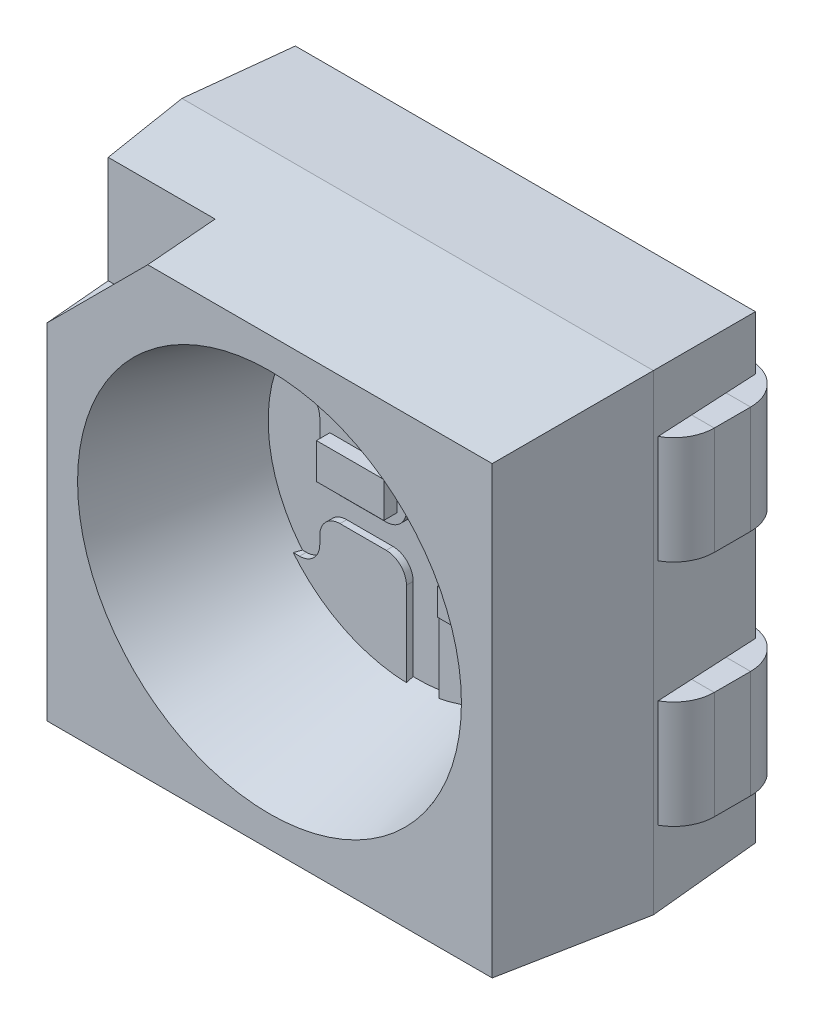
from build123d import *

# Parameters (mm, degrees)
SKETCH_1_W                       = 3.5
SKETCH_1_H                       = 3.5
EXTRUDE_1_DEPTH                  = 0.8
EXTRUDE_1_DRAFT                  = -3
SKETCH_3_R                       = 0.55
SKETCH_3_W                       = 0.705840171
SKETCH_3_H                       = 0.8
SKETCH_3_W_2                     = 0.610307383
CUT_EXTRUDE_1_DEPTH              = 0.13
SKETCH_5_W                       = 0.7
SKETCH_5_H                       = 0.8
SM_BASE_FLANGE_1_DEPTH           = 0.2
SM_EDGE_FLANGE_1_STRIP_W         = 1
SM_EDGE_FLANGE_1_STRIP_H         = 0.2
SM_EDGE_FLANGE_1_STRIP_CUT_DEPTH = 0.8
SM_EDGE_FLANGE_1_DEPTH           = 0.8
SM_EDGE_FLANGE_2_STRIP_W         = 1
SM_EDGE_FLANGE_2_STRIP_H         = 0.2
SM_EDGE_FLANGE_2_STRIP_CUT_DEPTH = 0.8
SM_EDGE_FLANGE_2_DEPTH           = 0.8
PATTERN_LINEAR_1_COUNT           = 2
PATTERN_LINEAR_1_PITCH           = 1.7
SKETCH_30_W                      = 3.5
SKETCH_30_H                      = 3.5
EXTRUDE_3_DEPTH                  = 1.1
EXTRUDE_3_TAPER                  = 5
CUT_EXTRUDE_2_DEPTH              = 0.5
SKETCH_34_R                      = 1.1
CUT_EXTRUDE_3_DEPTH              = 1.1
CHAMFER_1_SIZE                   = 0.325
CHAMFER_1_SIZE_2                 = 1.133409694
EXTRUDE_4_DEPTH                  = 0.05
EXTRUDE_4_2_DEPTH                = 0.05
EXTRUDE_4_3_DEPTH                = 0.05
EXTRUDE_4_4_DEPTH                = 0.05
SKETCH_49_W                      = 0.499821424
SKETCH_49_H                      = 0.263797991
EXTRUDE_5_DEPTH                  = 0.1
SKETCH_49_W_2                    = 0.2
SKETCH_49_H_2                    = 0.2
EXTRUDE_5_2_DEPTH                = 0.1
SKETCH_49_W_3                    = 0.191122393
EXTRUDE_5_3_DEPTH                = 0.1
SKETCH_49_W_4                    = 0.185203988
EXTRUDE_5_4_DEPTH                = 0.1


# Sheet-metal steps are written as plain solids
with BuildPart() as part:
    # Sketch 1 → Бобышка-Вытянуть1 (with draft: the straight prism first)
    with BuildSketch(Plane.XY):
        Rectangle(SKETCH_1_W, SKETCH_1_H)
    extrude(amount=-EXTRUDE_1_DEPTH)
    # Бобышка-Вытянуть1: the draft: its side faces are tilted about the plane it starts from
    extrude_1_sides = [part.faces().sort_by_distance(p)[0] for p in [
        (-1.75, 0, -0.4),
        (0, -1.75, -0.4),
        (1.75, 0, -0.4),
        (0, 1.75, -0.4),
    ]]
    draft(extrude_1_sides, Plane.XY, EXTRUDE_1_DRAFT)

    # Sketch 3 → Вырез-Вытянуть1 (cut)
    with BuildSketch(Plane(origin=(0, 0, -0.8), x_dir=(-1, 0, 0), z_dir=(0, 0, -1))):
        Circle(SKETCH_3_R)
        with Locations((-1.355153691, 0.906864755)):
            Rectangle(SKETCH_3_W, SKETCH_3_H)
        with Locations((1.402920085, 0.906864755)):
            Rectangle(SKETCH_3_W_2, SKETCH_3_H)
        with Locations((-1.355153691, -0.793135245)):
            Rectangle(SKETCH_3_W, SKETCH_3_H)
        with Locations((1.402920085, -1.031434947)):
            Rectangle(SKETCH_3_W_2, SKETCH_3_H)
    extrude(amount=-CUT_EXTRUDE_1_DEPTH, mode=Mode.SUBTRACT)



with BuildPart() as body_2:
    # Sketch 5 → Базовая кромка1 (new body)
    with BuildSketch(Plane(origin=(0, 0, -0.67), x_dir=(-1, 0, 0), z_dir=(0, 0, -1))):
        with Locations((-1.352233606, 0.906864755)):
            Rectangle(SKETCH_5_W, SKETCH_5_H)
    extrude(amount=SM_BASE_FLANGE_1_DEPTH)

    # Ребро-кромка1 strip (across the edge) → Ребро-кромка1 strip cut (cut)
    with BuildSketch(Plane(origin=(1.702233606, 0.506864755, -0.67), x_dir=(-1, 0, 0), z_dir=(0, 1, 0))):
        with Locations((-0.4, -0.1)):
            Rectangle(SM_EDGE_FLANGE_1_STRIP_W, SM_EDGE_FLANGE_1_STRIP_H)
    extrude(amount=SM_EDGE_FLANGE_1_STRIP_CUT_DEPTH, mode=Mode.SUBTRACT)

    # Ребро-кромка1 section (across the edge) → Ребро-кромка1 (add)
    with BuildSketch(Plane(origin=(1.702233606, 0.506864755, -0.67), x_dir=(-1, 0, 0), z_dir=(0, 1, 0))):
        with BuildLine():
            Line((-0.2, 0.1), (-0.2, 0.67))
            Line((-0.2, 0.67), (0, 0.67))
            Line((0, 0.67), (0, 0.1))
            ThreePointArc((0, 0.1), (0.029289322, 0.029289322), (0.1, 0))
            Line((0.1, 0), (0.1, -0.2))
            ThreePointArc((0.1, -0.2), (-0.112132034, -0.112132034), (-0.2, 0.1))
        make_face()
    extrude(amount=SM_EDGE_FLANGE_1_DEPTH)

    # Ребро-кромка2 strip (across the edge) → Ребро-кромка2 strip cut (cut)
    with BuildSketch(Plane(origin=(1.702233606, 0.506864755, 0), x_dir=(0, 0, -1), z_dir=(0, 1, 0))):
        with Locations((-0.2, -0.1)):
            Rectangle(SM_EDGE_FLANGE_2_STRIP_W, SM_EDGE_FLANGE_2_STRIP_H)
    extrude(amount=SM_EDGE_FLANGE_2_STRIP_CUT_DEPTH, mode=Mode.SUBTRACT)

    # Ребро-кромка2 section (across the edge) → Ребро-кромка2 (add)
    with BuildSketch(Plane(origin=(1.702233606, 0.506864755, 0), x_dir=(0, 0, -1), z_dir=(0, 1, 0))):
        with BuildLine():
            Line((0, 0.1), (0, 0.4))
            Line((0, 0.4), (0.2, 0.4))
            Line((0.2, 0.4), (0.2, 0.1))
            ThreePointArc((0.2, 0.1), (0.229289322, 0.029289322), (0.3, 0))
            Line((0.3, 0), (0.3, -0.2))
            ThreePointArc((0.3, -0.2), (0.087867966, -0.112132034), (0, 0.1))
        make_face()
    extrude(amount=SM_EDGE_FLANGE_2_DEPTH)


with BuildPart() as pattern_linear_1_1:
    # Линейный массив1: pattern copy
    add(body_2.part.moved(Location(Vector(0, -1, 0) * (1 * PATTERN_LINEAR_1_PITCH))))


with BuildPart() as body_4:
    # Зеркальное отражение1: mirrored copy
    add(body_2.part.mirror(Plane(origin=(0, 0, 0), x_dir=(0, 0, 1), z_dir=(1, 0, 0))))


with BuildPart() as body_5:
    # Mirror 1 2: mirrored copy
    add(pattern_linear_1_1.part.mirror(Plane(origin=(0, 0, 0), x_dir=(0, 0, 1), z_dir=(1, 0, 0))))


with BuildPart() as part_1:
    add(part.part)

    add(body_2.part)  # Бобышка-Вытянуть3 merges body 2

    add(pattern_linear_1_1.part)  # Бобышка-Вытянуть3 merges Линейный массив1_1

    add(body_4.part)  # Бобышка-Вытянуть3 merges body 4

    add(body_5.part)  # Бобышка-Вытянуть3 merges body 5
    # Эскиз30 → Бобышка-Вытянуть3 (add)
    with BuildSketch(Plane.XY):
        Rectangle(SKETCH_30_W, SKETCH_30_H)
    extrude(amount=EXTRUDE_3_DEPTH, taper=EXTRUDE_3_TAPER)

    # Эскиз33 → Вырез-Вытянуть2 (cut)
    with BuildSketch(Plane.XY.offset(1.1)):
        Polygon((-0.90376247, 1.65376247), (-1.65376247, 0.90376247), (-2.879687624, 0.90376247), (-2.879687624, 2.879687624), (-0.90376247, 2.879687624), align=None)
    extrude(amount=-CUT_EXTRUDE_2_DEPTH, mode=Mode.SUBTRACT)

    # Эскиз34 → Вырез-Вытянуть3 (cut)
    with BuildSketch(Plane.XY.offset(1.1)):
        Circle(SKETCH_34_R)
    extrude(amount=-CUT_EXTRUDE_3_DEPTH, mode=Mode.SUBTRACT)

    # Фаска1
    # the kernel refuses this chamfer: 1.133409694, 0.325 mm, written as the material it takes off along each edge
    with BuildSketch(Plane(origin=(0, 0, 1.1), x_dir=(1, 0, 0), z_dir=(0, -1, 0))) as chamfer_1_piece_1_section:
        Polygon((1.1 + CHAMFER_1_SIZE, 0), (1.1, -CHAMFER_1_SIZE_2), (1.1, 0), align=None)
    chamfer_1_piece_1 = revolve(axis=Axis((0, 0, 1.1), (0, 0, 1)), mode=Mode.PRIVATE)
    chamfer_1_piece_1 = split(chamfer_1_piece_1, bisect_by=Plane(origin=(-1.262154842, 0, 0), z_dir=(0, 0, 1)), keep=Keep.TOP, mode=Mode.PRIVATE)
    add(chamfer_1_piece_1, mode=Mode.SUBTRACT)


with BuildPart() as body_2_2:
    # Эскиз48 → Бобышка-Вытянуть4 (new body)
    with BuildSketch(Plane.XY):
        with BuildLine():
            Line((0.210318716, -1.45465193), (0.210318716, 0.099827842))
            ThreePointArc((0.210318716, 0.099827842), (0.254252699, 0.205893859), (0.360318716, 0.249827842))
            Line((0.360318716, 0.249827842), (0.596091857, 0.249827842))
            ThreePointArc((0.596091857, 0.249827842), (0.702157875, 0.205893859), (0.746091857, 0.099827842))
            Line((0.746091857, 0.099827842), (0.746091857, -0.686015987))
            ThreePointArc((0.746091857, -0.686015987), (0.79002584, -0.792082004), (0.896091857, -0.836015987))
            Line((0.896091857, -0.836015987), (1.321228911, -0.836015987))
            Line((1.321228911, -0.836015987), (1.321228911, -1.45465193))
            Line((1.321228911, -1.45465193), (0.210318716, -1.45465193))
        make_face()
    extrude(amount=EXTRUDE_4_DEPTH)


with BuildPart() as body_3:
    # Эскиз48 → Extrude 4 2 (new body)
    with BuildSketch(Plane.XY):
        with BuildLine():
            Line((0.210318716, 1.509106996), (1.529342803, 1.509106996))
            Line((1.529342803, 1.509106996), (1.529342803, 0.436478181))
            Line((1.529342803, 0.436478181), (0.360318716, 0.436478181))
            ThreePointArc((0.360318716, 0.436478181), (0.254252699, 0.480412163), (0.210318716, 0.586478181))
            Line((0.210318716, 0.586478181), (0.210318716, 1.509106996))
        make_face()
    extrude(amount=EXTRUDE_4_2_DEPTH)


with BuildPart() as body_4_2:
    # Эскиз48 → Extrude 4 3 (new body)
    with BuildSketch(Plane.XY):
        with BuildLine():
            Line((-0.033165046, -1.549652247), (-0.033165046, -0.49711606))
            ThreePointArc((-0.033165046, -0.49711606), (-0.077099029, -0.391050043), (-0.183165046, -0.34711606))
            Line((-0.183165046, -0.34711606), (-0.526546559, -0.34711606))
            ThreePointArc((-0.526546559, -0.34711606), (-0.632612577, -0.391050043), (-0.676546559, -0.49711606))
            Line((-0.676546559, -0.49711606), (-0.676546559, -0.556593928))
            ThreePointArc((-0.676546559, -0.556593928), (-0.720480542, -0.662659945), (-0.826546559, -0.706593928))
            Line((-0.826546559, -0.706593928), (-1.505672411, -0.706593928))
            Line((-1.505672411, -0.706593928), (-1.505672411, -1.549652247))
            Line((-1.505672411, -1.549652247), (-0.033165046, -1.549652247))
        make_face()
    extrude(amount=EXTRUDE_4_3_DEPTH)


with BuildPart() as body_5_2:
    # Эскиз48 → Extrude 4 4 (new body)
    with BuildSketch(Plane.XY):
        with BuildLine():
            Line((-0.033165046, 1.512774786), (-1.482564226, 1.512774786))
            Line((-1.482564226, 1.512774786), (-1.482564226, 0.407787462))
            Line((-1.482564226, 0.407787462), (-0.826546559, 0.407787462))
            ThreePointArc((-0.826546559, 0.407787462), (-0.720480542, 0.363853479), (-0.676546559, 0.257787462))
            Line((-0.676546559, 0.257787462), (-0.676546559, -0.015579737))
            ThreePointArc((-0.676546559, -0.015579737), (-0.632612577, -0.121645754), (-0.526546559, -0.165579737))
            Line((-0.526546559, -0.165579737), (-0.183165046, -0.165579737))
            ThreePointArc((-0.183165046, -0.165579737), (-0.077099029, -0.121645754), (-0.033165046, -0.015579737))
            Line((-0.033165046, -0.015579737), (-0.033165046, 1.512774786))
        make_face()
    extrude(amount=EXTRUDE_4_4_DEPTH)


with BuildPart() as body_6:
    # Эскиз49 → Бобышка-Вытянуть5 (new body)
    with BuildSketch(Plane.XY.offset(0.05)):
        with Locations((-0.351547158, 0.067536346)):
            Rectangle(SKETCH_49_W, SKETCH_49_H)
    extrude(amount=EXTRUDE_5_DEPTH)


with BuildPart() as body_7:
    # Эскиз49 → Extrude 5 2 (new body)
    with BuildSketch(Plane.XY.offset(0.05)):
        with Locations((0.397136578, 0.621269056)):
            Rectangle(SKETCH_49_W_2, SKETCH_49_H_2)
    extrude(amount=EXTRUDE_5_2_DEPTH)


with BuildPart() as body_8:
    # Эскиз49 → Extrude 5 3 (new body)
    with BuildSketch(Plane.XY.offset(0.05)):
        with Locations((0.392697775, 0.060540571)):
            Rectangle(SKETCH_49_W_3, SKETCH_49_H_2)
    extrude(amount=EXTRUDE_5_3_DEPTH)


with BuildPart() as body_9:
    # Эскиз49 → Extrude 5 4 (new body)
    with BuildSketch(Plane.XY.offset(0.05)):
        with Locations((0.389738572, -0.387189749)):
            Rectangle(SKETCH_49_W_4, SKETCH_49_H_2)
    extrude(amount=EXTRUDE_5_4_DEPTH)


solid = Compound([part_1.part, body_2_2.part, body_3.part, body_4_2.part, body_5_2.part, body_6.part, body_7.part, body_8.part, body_9.part])
